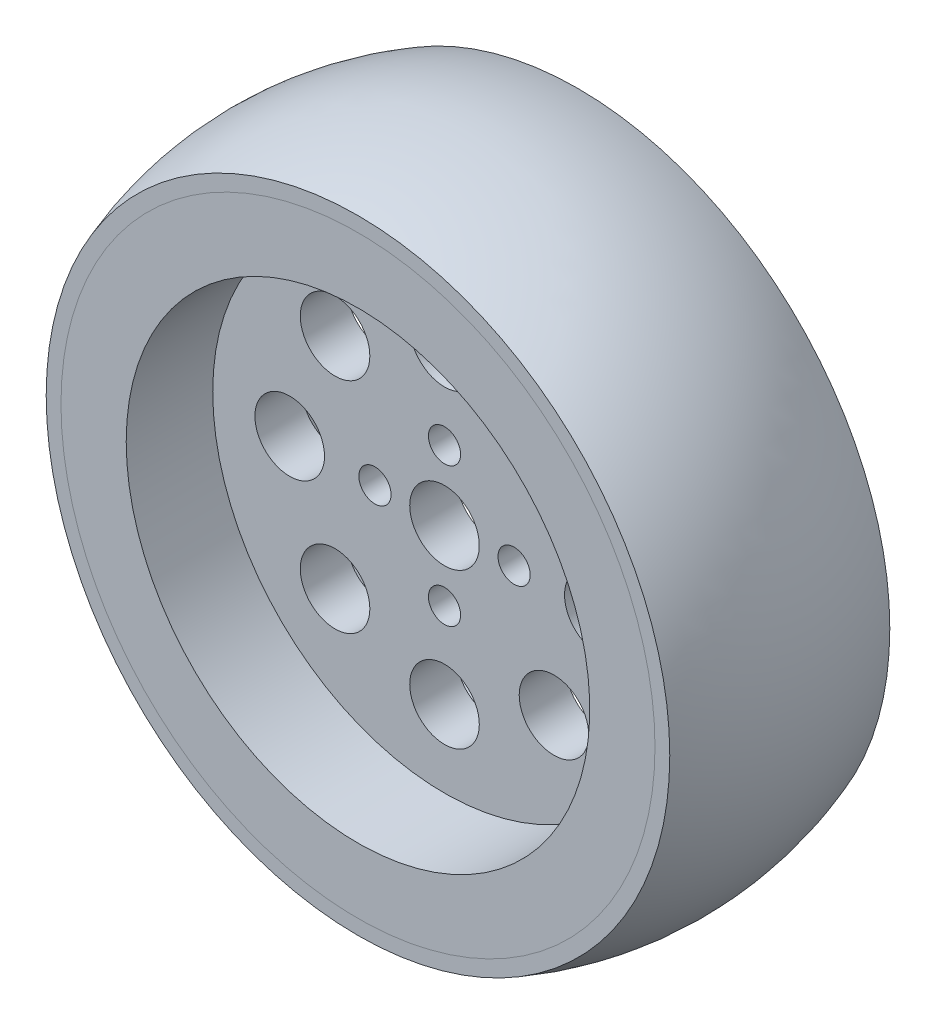
from build123d import *

# Parameters (mm, degrees)
CUT_EXTRUDE1_DEPTH      = 56.346567353
CUT_EXTRUDE1_DEPTH_BACK = 56.346567353
SKETCH3_R               = 1.85
SKETCH3_R_2             = 4


with BuildPart() as part:
    # Sketch1 → Revolve1 (revolve)
    with BuildSketch(Plane(origin=(0, 0, 0), x_dir=(1, 0, 0), z_dir=(0, 1, 0))):
        Polygon((4, 2.7), (4, -2.7), (26.65, -2.7), (26.65, -12.65), (34.15, -12.65), (34.15, -10.65), (31.85, -10.65), (31.85, 10.65), (34.15, 10.65), (34.15, 12.65), (26.65, 12.65), (26.65, 2.7), align=None)
    revolve(axis=Axis((0, 0, -12.65), (0, 0, 1)))

    # Sketch3 → Cut-Extrude1 (cut, two sides: drawn at the far end of the back side and taken through both)
    with BuildSketch(Plane.XY.offset(-CUT_EXTRUDE1_DEPTH_BACK)):
        with Locations((0, 8)):
            Circle(SKETCH3_R)
        with Locations((8, 0)):
            Circle(SKETCH3_R)
        with Locations((0, -8)):
            Circle(SKETCH3_R)
        with Locations((-8, 0)):
            Circle(SKETCH3_R)
        with Locations((0, 17.8)):
            Circle(SKETCH3_R_2)
        with Locations((12.586500705, 12.586500705)):
            Circle(SKETCH3_R_2)
        with Locations((17.8, 0)):
            Circle(SKETCH3_R_2)
        with Locations((12.586500705, -12.586500705)):
            Circle(SKETCH3_R_2)
        with Locations((0, -17.8)):
            Circle(SKETCH3_R_2)
        with Locations((-12.586500705, -12.586500705)):
            Circle(SKETCH3_R_2)
        with Locations((-17.8, 0)):
            Circle(SKETCH3_R_2)
        with Locations((-12.586500705, 12.586500705)):
            Circle(SKETCH3_R_2)
    extrude(amount=CUT_EXTRUDE1_DEPTH + CUT_EXTRUDE1_DEPTH_BACK, mode=Mode.SUBTRACT)


with BuildPart() as body_2:
    # Sketch2 → Revolve2 (revolve)
    with BuildSketch(Plane(origin=(0, 0, 0), x_dir=(1, 0, 0), z_dir=(0, 1, 0))):
        with BuildLine():
            Line((31.85, -10.65), (31.85, 10.65))
            Line((31.85, 10.65), (34.15, 10.65))
            Line((34.15, 10.65), (34.15, 12.65))
            Line((34.15, 12.65), (35.85, 12.65))
            ThreePointArc((35.85, 12.65), (38.1, 0), (35.85, -12.65))
            Line((35.85, -12.65), (34.15, -12.65))
            Line((34.15, -12.65), (34.15, -10.65))
            Line((34.15, -10.65), (31.85, -10.65))
        make_face()
    revolve(axis=Axis((0, 0, 0), (0, 0, 1)))


solid = Compound([part.part, body_2.part])
